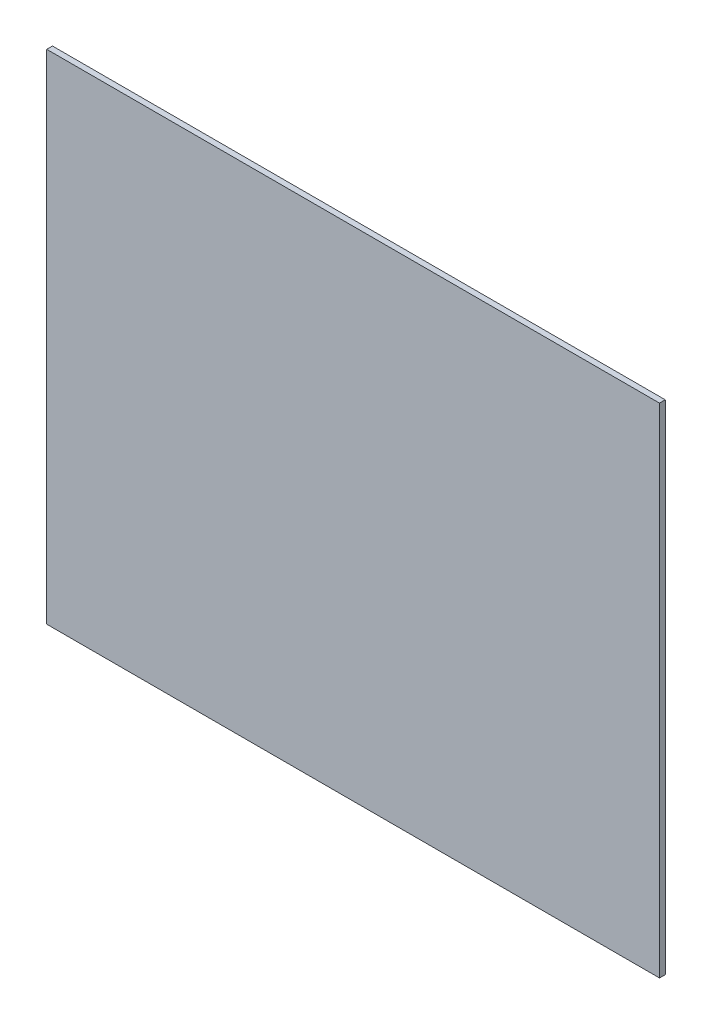
from build123d import *

# Parameters (mm, degrees)
SKETCH_1_W      = 320
SKETCH_1_H      = 260
EXTRUDE_1_DEPTH = 3


with BuildPart() as part:
    # Эскиз1 → Бобышка-Вытянуть1 (new body)
    with BuildSketch(Plane.XY):
        Rectangle(SKETCH_1_W, SKETCH_1_H)
    extrude(amount=EXTRUDE_1_DEPTH)


solid = part.part
